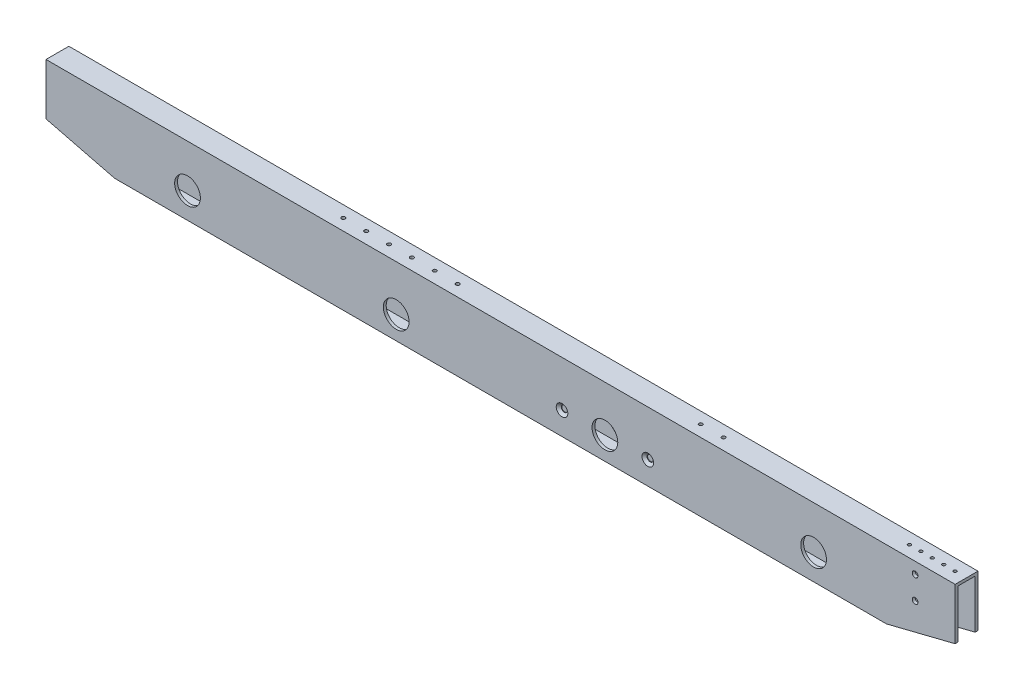
from build123d import *

# Parameters (mm, degrees)
SKETCH1_W                                           = 1009.65
SKETCH1_H                                           = 76.2
SKETCH1_R                                           = 14.2875
BOSS_EXTRUDE2_DEPTH                                 = 12.7
SKETCH3_W                                           = 19.05
SKETCH3_H                                           = 69.85
CUT_EXTRUDE2_DEPTH                                  = 1011.448426442
CUT_EXTRUDE3_DEPTH                                  = 507.897475457
SKETCH9_R                                           = 1.7272
CUT_EXTRUDE4_DEPTH                                  = 2.54
SKETCH12_R                                          = 2.0193
CUT_EXTRUDE7_DEPTH                                  = 5.08
CSK_FOR_1_4_FLAT_HEAD_MACHINE_SCREW_100_D           = 6.7564
CSK_FOR_1_4_FLAT_HEAD_MACHINE_SCREW_100_CSINK_D     = 12.8778
CSK_FOR_1_4_FLAT_HEAD_MACHINE_SCREW_100_CSINK_ANGLE = 100
SKETCH17_R                                          = 1.7272
CUT_EXTRUDE8_DEPTH                                  = 6.35
SKETCH18_R                                          = 17.4625
CUT_EXTRUDE9_DEPTH                                  = 3.81
F_1_4_0_25_DIAMETER_HOLE1_D                         = 6.35
F_10_32_TAPPED_HOLE2_D                              = 4.0386


with BuildPart() as part:
    # Sketch1 → Boss-Extrude2 (new, symmetric)
    with BuildSketch(Plane.XY):
        Rectangle(SKETCH1_W, SKETCH1_H)
        with Locations((-115.8875, -12.7)):
            Circle(SKETCH1_R, mode=Mode.SUBTRACT)
        with Locations((115.8875, -12.7)):
            Circle(SKETCH1_R, mode=Mode.SUBTRACT)
        with Locations((-347.6625, -9.525)):
            Circle(SKETCH1_R, mode=Mode.SUBTRACT)
        with Locations((347.6625, -9.525)):
            Circle(SKETCH1_R, mode=Mode.SUBTRACT)
    extrude(amount=BOSS_EXTRUDE2_DEPTH, both=True)

    # Sketch3 → Cut-Extrude2 (cut, through all)
    with BuildSketch(Plane(origin=(504.825, 0, 0), x_dir=(0, 0, -1), z_dir=(1, 0, 0))):
        Rectangle(SKETCH3_W, SKETCH3_H)
    extrude(amount=-CUT_EXTRUDE2_DEPTH, mode=Mode.SUBTRACT)

    # Sketch4 → Cut-Extrude3 (cut, through all)
    with BuildSketch(Plane.XY.offset(12.7)):
        Polygon((-504.825, -38.1), (-504.825, -19.05), (-428.625, -38.1), align=None)
        Polygon((428.625, -38.1), (504.825, -38.1), (504.825, -19.05), align=None)
    extrude(amount=-CUT_EXTRUDE3_DEPTH, mode=Mode.SUBTRACT)

    # Sketch9 → Cut-Extrude4 (cut)
    with BuildSketch(Plane(origin=(0, 38.1, 0), x_dir=(1, 0, 0), z_dir=(0, 1, 0))):
        with Locations((492.125, 0)):
            Circle(SKETCH9_R)
        with Locations((479.425, 0)):
            Circle(SKETCH9_R)
        with Locations((466.725, 0)):
            Circle(SKETCH9_R)
        with Locations((454.025, 0)):
            Circle(SKETCH9_R)
        with Locations((441.325, 0)):
            Circle(SKETCH9_R)
    extrude(amount=-CUT_EXTRUDE4_DEPTH, mode=Mode.SUBTRACT)

    # Sketch12 → Cut-Extrude7 (cut)
    with BuildSketch(Plane(origin=(0, 38.1, 0), x_dir=(1, 0, 0), z_dir=(0, 1, 0))):
        with Locations((-187.325, 0)):
            Circle(SKETCH12_R)
        with Locations((-161.925, 0)):
            Circle(SKETCH12_R)
        with Locations((-136.525, 0)):
            Circle(SKETCH12_R)
        with Locations((-111.125, 0)):
            Circle(SKETCH12_R)
        with Locations((-85.725, 0)):
            Circle(SKETCH12_R)
        with Locations((-60.325, 0)):
            Circle(SKETCH12_R)
    extrude(amount=-CUT_EXTRUDE7_DEPTH, mode=Mode.SUBTRACT)

    # CSK for 1/4 Flat Head Machine Screw (100)2 (through all)
    with Locations(Plane.XY.offset(12.7)):
        with Locations((68.2625, -12.7), (163.5125, -12.7)):
            CounterSinkHole(CSK_FOR_1_4_FLAT_HEAD_MACHINE_SCREW_100_D / 2, CSK_FOR_1_4_FLAT_HEAD_MACHINE_SCREW_100_CSINK_D / 2, counter_sink_angle=CSK_FOR_1_4_FLAT_HEAD_MACHINE_SCREW_100_CSINK_ANGLE)

    # Sketch17 → Cut-Extrude8 (cut)
    with BuildSketch(Plane(origin=(0, -38.1, 0), x_dir=(-1, 0, 0), z_dir=(0, -1, 0))):
        with Locations((-396.875, 0)):
            Circle(SKETCH17_R)
        with Locations((-320.675, 0)):
            Circle(SKETCH17_R)
        with Locations((-244.475, 0)):
            Circle(SKETCH17_R)
        with Locations((-168.275, 0)):
            Circle(SKETCH17_R)
        with Locations((-92.075, 0)):
            Circle(SKETCH17_R)
        with Locations((-15.875, 0)):
            Circle(SKETCH17_R)
        with Locations((60.325, 0)):
            Circle(SKETCH17_R)
    extrude(amount=-CUT_EXTRUDE8_DEPTH, mode=Mode.SUBTRACT)

    # Sketch18 → Cut-Extrude9 (cut)
    with BuildSketch(Plane(origin=(0, 0, -12.7), x_dir=(-1, 0, 0), z_dir=(0, 0, -1))):
        with Locations((-115.8875, -12.7)):
            Circle(SKETCH18_R)
    extrude(amount=-CUT_EXTRUDE9_DEPTH, mode=Mode.SUBTRACT)

    # 1/4 (0.25) Diameter Hole1 (through all)
    with Locations(Plane.XY.offset(12.7)):
        with Locations((460.375, 25.4), (460.375, 0)):
            Hole(F_1_4_0_25_DIAMETER_HOLE1_D / 2)

    # #10-32 Tapped Hole2 (through all)
    with Locations(Plane(origin=(0, 38.1, 0), x_dir=(1, 0, 0), z_dir=(0, 1, 0))):
        with Locations((234.95, 0), (209.55, 0)):
            Hole(F_10_32_TAPPED_HOLE2_D / 2)


solid = part.part
